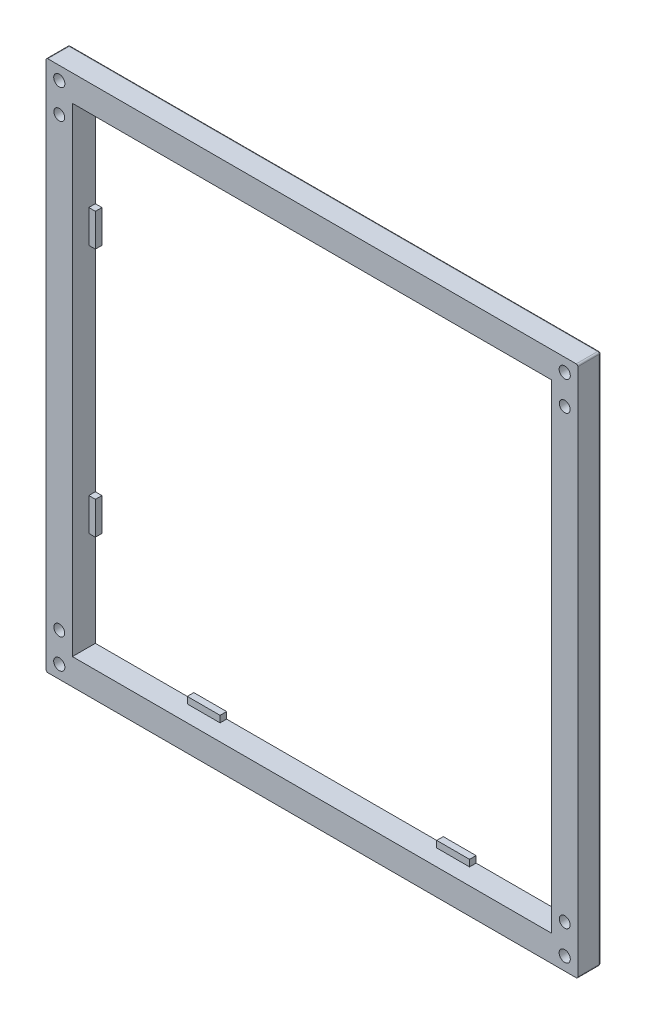
from build123d import *

# Parameters (mm, degrees)
SKETCH_1_W                                   = 162
SKETCH_1_H                                   = 162
SKETCH_1_W_2                                 = 146
SKETCH_1_H_2                                 = 146
EXTRUDE_375_DEPTH                            = 7
SKETCH_2_W                                   = 10
SKETCH_2_H                                   = 3
EXTRUDE_670_DEPTH                            = 2
PATTERN_CIRCULAR_761_COUNT                   = 4
PATTERN_CIRCULAR_761_COPY_1_SKETCH_W         = 10
PATTERN_CIRCULAR_761_COPY_1_SKETCH_H         = 3
PATTERN_CIRCULAR_761_COPY_1_DEPTH            = 2
PATTERN_CIRCULAR_761_COPY_2_SKETCH_W         = 10
PATTERN_CIRCULAR_761_COPY_2_SKETCH_H         = 3
PATTERN_CIRCULAR_761_COPY_2_DEPTH            = 2
PATTERN_CIRCULAR_761_COPY_3_SKETCH_W         = 10
PATTERN_CIRCULAR_761_COPY_3_SKETCH_H         = 3
PATTERN_CIRCULAR_761_COPY_3_DEPTH            = 2
SKETCH_3_R                                   = 1.7
CUT_EXTRUDE_1047_DEPTH                       = 115.764977236
MIRROR_1214_COPY_1_SKETCH_R                  = 1.7
MIRROR_1214_COPY_1_DEPTH                     = 115.764977236
SKETCH_4_R                                   = 1.65
CUT_EXTRUDE_1505_DEPTH                       = 3.5
MIRROR_1637_COPY_1_SKETCH_R                  = 1.65
MIRROR_1637_COPY_1_DEPTH                     = 3.5
CUT_EXTRUDE_2611_DEPTH                       = 2.6
MIRROR_2701_AT_THE_SECOND_PLANE_COPY_1_DEPTH = 2.6
FILLET_1_R                                   = 0.5
FILLET_2_R                                   = 0.5


with BuildPart() as part:
    # Эскиз1 → Extrude 375 (new body)
    with BuildSketch(Plane.XY):
        Rectangle(SKETCH_1_W, SKETCH_1_H)
        Rectangle(SKETCH_1_W_2, SKETCH_1_H_2, mode=Mode.SUBTRACT)
    extrude(amount=EXTRUDE_375_DEPTH)

    # Эскиз2 → Extrude 670 (add)
    with BuildSketch(Plane(origin=(0, 0, 0), x_dir=(-1, 0, 0), z_dir=(0, 0, -1))):
        with Locations((-38, 72.5)):
            Rectangle(SKETCH_2_W, SKETCH_2_H)
    extrude_670 = extrude(amount=-EXTRUDE_670_DEPTH)

    # Mirror 726: Extrude 670 across plane
    add(extrude_670.mirror(Plane(origin=(0, 0, 0), x_dir=(0, 0, 1), z_dir=(1, 0, 0))))

    # Pattern Circular 761: Extrude 670 ×4 about axis
    pattern_circular_761_axis = Axis((0, 0, 0), (0, 0, 1))
    for i in range(1, PATTERN_CIRCULAR_761_COUNT):
        add(extrude_670.rotate(pattern_circular_761_axis, i * 360 / PATTERN_CIRCULAR_761_COUNT))

    # Pattern Circular 761 copy 1 sketch → Pattern Circular 761 copy 1 (add)
    with BuildSketch(Plane.YX):
        with Locations((-38, -72.5)):
            Rectangle(PATTERN_CIRCULAR_761_COPY_1_SKETCH_W, PATTERN_CIRCULAR_761_COPY_1_SKETCH_H)
    extrude(amount=-PATTERN_CIRCULAR_761_COPY_1_DEPTH)

    # Pattern Circular 761 copy 2 sketch → Pattern Circular 761 copy 2 (add)
    with BuildSketch(Plane(origin=(0, 0, 0), x_dir=(-1, 0, 0), z_dir=(0, 0, -1))):
        with Locations((-38, -72.5)):
            Rectangle(PATTERN_CIRCULAR_761_COPY_2_SKETCH_W, PATTERN_CIRCULAR_761_COPY_2_SKETCH_H)
    extrude(amount=-PATTERN_CIRCULAR_761_COPY_2_DEPTH)

    # Pattern Circular 761 copy 3 sketch → Pattern Circular 761 copy 3 (add)
    with BuildSketch(Plane(origin=(0, 0, 0), x_dir=(0, -1, 0), z_dir=(0, 0, -1))):
        with Locations((-38, -72.5)):
            Rectangle(PATTERN_CIRCULAR_761_COPY_3_SKETCH_W, PATTERN_CIRCULAR_761_COPY_3_SKETCH_H)
    extrude(amount=-PATTERN_CIRCULAR_761_COPY_3_DEPTH)

    # Эскиз3 → Cut-Extrude 1047 (cut, through all)
    with BuildSketch(Plane.XY.offset(7)):
        with Locations((-77, 77)):
            Circle(SKETCH_3_R)
    cut_extrude_1047 = extrude(amount=-CUT_EXTRUDE_1047_DEPTH, mode=Mode.SUBTRACT)

    # Mirror 1158: Cut-Extrude 1047 across plane
    add(cut_extrude_1047.mirror(Plane(origin=(0, 0, 0), x_dir=(0, 0, 1), z_dir=(1, 0, 0))), mode=Mode.SUBTRACT)

    # Mirror 1214: Cut-Extrude 1047 across plane
    add(cut_extrude_1047.mirror(Plane.ZX), mode=Mode.SUBTRACT)

    # Mirror 1214 copy 1 sketch → Mirror 1214 copy 1 (cut, through all)
    with BuildSketch(Plane(origin=(0, 0, 7), x_dir=(-1, 0, 0), z_dir=(0, 0, 1))):
        with Locations((-77, 77)):
            Circle(MIRROR_1214_COPY_1_SKETCH_R)
    extrude(amount=-MIRROR_1214_COPY_1_DEPTH, mode=Mode.SUBTRACT)

    # Эскиз4 → Cut-Extrude 1505 (cut)
    with BuildSketch(Plane.XY.offset(7)):
        with Locations((-77, 68)):
            Circle(SKETCH_4_R)
    cut_extrude_1505 = extrude(amount=-CUT_EXTRUDE_1505_DEPTH, mode=Mode.SUBTRACT)

    # Mirror 1581: Cut-Extrude 1505 across plane
    add(cut_extrude_1505.mirror(Plane(origin=(0, 0, 0), x_dir=(0, 0, 1), z_dir=(1, 0, 0))), mode=Mode.SUBTRACT)

    # Mirror 1637: Cut-Extrude 1505 across plane
    add(cut_extrude_1505.mirror(Plane.ZX), mode=Mode.SUBTRACT)

    # Mirror 1637 copy 1 sketch → Mirror 1637 copy 1 (cut)
    with BuildSketch(Plane(origin=(0, 0, 7), x_dir=(-1, 0, 0), z_dir=(0, 0, 1))):
        with Locations((-77, 68)):
            Circle(MIRROR_1637_COPY_1_SKETCH_R)
    extrude(amount=-MIRROR_1637_COPY_1_DEPTH, mode=Mode.SUBTRACT)

    # Эскиз5 → Cut-Extrude 2611 (cut)
    with BuildSketch(Plane(origin=(0, 0, 0), x_dir=(-1, 0, 0), z_dir=(0, 0, -1))):
        Polygon((-73.651368439, 77), (-75.325684219, 79.9), (-78.674315781, 79.9), (-80.348631561, 77), (-78.674315781, 74.1), (-75.325684219, 74.1), align=None)
    cut_extrude_2611 = extrude(amount=-CUT_EXTRUDE_2611_DEPTH, mode=Mode.SUBTRACT)

    # Mirror 2701: Cut-Extrude 2611 across plane
    add(cut_extrude_2611.mirror(Plane(origin=(0, 0, 0), x_dir=(0, 0, 1), z_dir=(1, 0, 0))), mode=Mode.SUBTRACT)

    # Mirror 2701 at the second plane: Cut-Extrude 2611 across plane
    add(cut_extrude_2611.mirror(Plane.ZX), mode=Mode.SUBTRACT)

    # Mirror 2701 at the second plane copy 1 s → Mirror 2701 at the second plane copy 1 (cut)
    with BuildSketch(Plane(origin=(0, 0, 0), x_dir=(1, 0, 0), z_dir=(0, 0, -1))):
        Polygon((-73.651368439, 77), (-75.325684219, 79.9), (-78.674315781, 79.9), (-80.348631561, 77), (-78.674315781, 74.1), (-75.325684219, 74.1), align=None)
    extrude(amount=-MIRROR_2701_AT_THE_SECOND_PLANE_COPY_1_DEPTH, mode=Mode.SUBTRACT)

    # Скругление1
    fillet_1_edges = [part.edges().sort_by_distance(p)[0] for p in [
        (0, -81, 0),
        (-81, 0, 0),
        (0, 81, 0),
        (81, 0, 0),
    ]]
    fillet(fillet_1_edges, radius=FILLET_1_R)

    # Скругление2
    # the kernel refuses this fillet: 0.5 mm, written as the material it takes off along each edge
    with BuildSketch(Plane(origin=(-80.5, 80.5, 0.5), x_dir=(-1, 0, 0), z_dir=(0, 1, 0))) as fillet_2_piece_1_section:
        Polygon((0, 0), (FILLET_2_R, 0), (FILLET_2_R, -FILLET_2_R), (0, -FILLET_2_R), align=None)
    fillet_2_piece_1 = extrude(amount=FILLET_2_R, mode=Mode.PRIVATE)
    fillet_2_piece_1 = fillet_2_piece_1 - Plane(origin=(-80.5, 80.5, 0.5), x_dir=(0.7071067811865475, 0, 0.7071067811865475), z_dir=(0, 1, 0)) * Sphere(FILLET_2_R, mode=Mode.PRIVATE)
    add(fillet_2_piece_1, mode=Mode.SUBTRACT)
    with BuildSketch(Plane(origin=(80.5, 80.5, 0.5), x_dir=(1, 0, 0), z_dir=(0, 1, 0))) as fillet_2_piece_2_section:
        Polygon((0, 0), (FILLET_2_R, 0), (FILLET_2_R, FILLET_2_R), (0, FILLET_2_R), align=None)
    fillet_2_piece_2 = extrude(amount=FILLET_2_R, mode=Mode.PRIVATE)
    fillet_2_piece_2 = fillet_2_piece_2 - Plane(origin=(80.5, 80.5, 0.5), x_dir=(-0.7071067811865475, 0, 0.7071067811865475), z_dir=(0, 1, 0)) * Sphere(FILLET_2_R, mode=Mode.PRIVATE)
    add(fillet_2_piece_2, mode=Mode.SUBTRACT)
    with BuildSketch(Plane(origin=(-80.5, -80.5, 0.5), x_dir=(0, -1, 0), z_dir=(-1, 0, 0))) as fillet_2_piece_3_section:
        Polygon((0, 0), (FILLET_2_R, 0), (FILLET_2_R, -FILLET_2_R), (0, -FILLET_2_R), align=None)
    fillet_2_piece_3 = extrude(amount=FILLET_2_R, mode=Mode.PRIVATE)
    fillet_2_piece_3 = fillet_2_piece_3 - Plane(origin=(-80.5, -80.5, 0.5), x_dir=(0, 0.7071067811865475, 0.7071067811865475), z_dir=(-1, 0, 0)) * Sphere(FILLET_2_R, mode=Mode.PRIVATE)
    add(fillet_2_piece_3, mode=Mode.SUBTRACT)
    with BuildSketch(Plane(origin=(80.5, -80.5, 0.5), x_dir=(0, -1, 0), z_dir=(1, 0, 0))) as fillet_2_piece_4_section:
        Polygon((0, 0), (FILLET_2_R, 0), (FILLET_2_R, FILLET_2_R), (0, FILLET_2_R), align=None)
    fillet_2_piece_4 = extrude(amount=FILLET_2_R, mode=Mode.PRIVATE)
    fillet_2_piece_4 = fillet_2_piece_4 - Plane(origin=(80.5, -80.5, 0.5), x_dir=(0, 0.7071067811865475, 0.7071067811865475), z_dir=(1, 0, 0)) * Sphere(FILLET_2_R, mode=Mode.PRIVATE)
    add(fillet_2_piece_4, mode=Mode.SUBTRACT)
    with BuildSketch(Plane(origin=(81, -81, 0.5), x_dir=(0, 1, 0), z_dir=(0, 0, 1)), Plane(origin=(81, 81, 0.5), x_dir=(-1, 0, 0), z_dir=(0, 0, 1))) as fillet_2_piece_5:
        with BuildLine():
            CenterArc((FILLET_2_R, FILLET_2_R), FILLET_2_R, 180, 90)
            Line((0, FILLET_2_R), (0, 0))
            Line((0, 0), (FILLET_2_R, 0))
        make_face()
    extrude(amount=7.75, mode=Mode.SUBTRACT)
    with BuildSketch(Plane(origin=(-81, -81, 0.5), x_dir=(0, 1, 0), z_dir=(0, 0, 1)), Plane(origin=(-81, 81, 0.5), x_dir=(1, 0, 0), z_dir=(0, 0, 1))) as fillet_2_piece_6:
        with BuildLine():
            CenterArc((FILLET_2_R, -FILLET_2_R), FILLET_2_R, 90, 90)
            Line((0, -FILLET_2_R), (0, 0))
            Line((0, 0), (FILLET_2_R, 0))
        make_face()
    extrude(amount=7.75, mode=Mode.SUBTRACT)


solid = part.part
